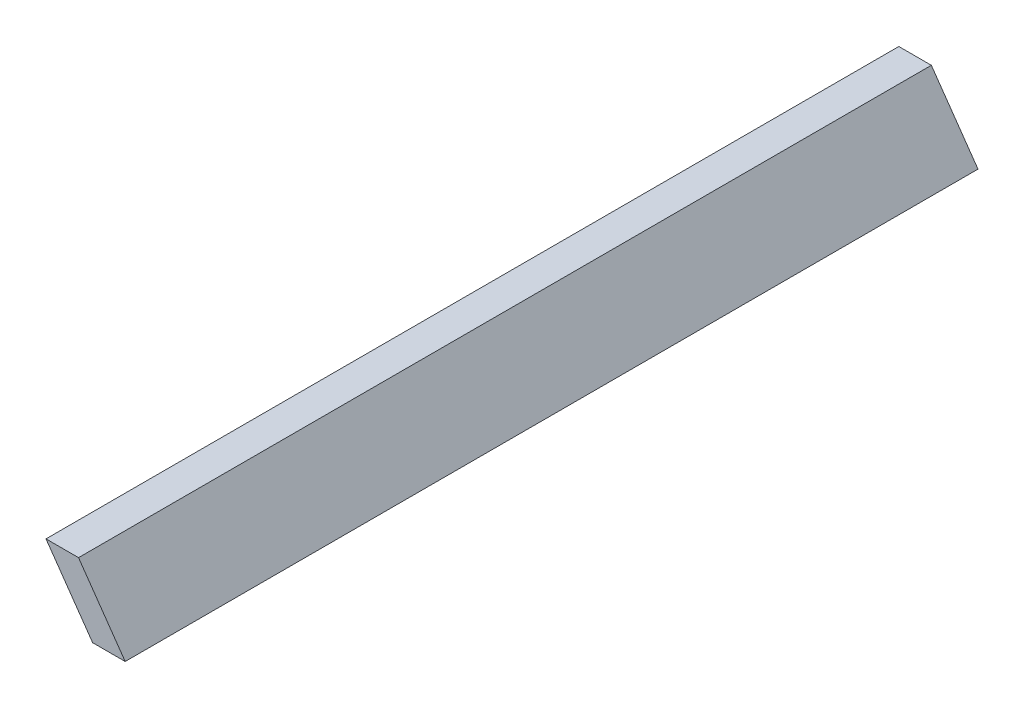
from build123d import *

# Parameters (mm, degrees)
BOSS_EXTRUDE1_DEPTH = 203.2
CUT_EXTRUDE1_DEPTH  = 7.112


with BuildPart() as part:
    # end-profile → Boss-Extrude1 (new body)
    with BuildSketch(Plane.XY):
        Polygon((0, 0), (-7.751918639, 0), (-18.867713308, 15.875), (-11.115794669, 15.875), align=None)
    extrude(amount=BOSS_EXTRUDE1_DEPTH)

    # Sketch4 → Cut-Extrude1 (cut)
    with BuildSketch(Plane(origin=(-18.867713308, 0, 0), x_dir=(0, 0, -1), z_dir=(1, 0, 0))):
        with BuildLine():
            Line((-181.18709, 7.9375), (-181.18709, 0))
            Line((-181.18709, 0), (-174.41291, 0))
            Line((-174.41291, 0), (-174.41291, 7.9375))
            ThreePointArc((-174.41291, 7.9375), (-177.8, 11.32459), (-181.18709, 7.9375))
        make_face()
        with BuildLine():
            Line((-143.08709, 7.9375), (-143.08709, 0))
            Line((-143.08709, 0), (-136.31291, 0))
            Line((-136.31291, 0), (-136.31291, 7.9375))
            ThreePointArc((-136.31291, 7.9375), (-139.7, 11.32459), (-143.08709, 7.9375))
        make_face()
        with BuildLine():
            Line((-104.98709, 7.9375), (-104.98709, 0))
            Line((-104.98709, 0), (-98.21291, 0))
            Line((-98.21291, 0), (-98.21291, 7.9375))
            ThreePointArc((-98.21291, 7.9375), (-101.6, 11.32459), (-104.98709, 7.9375))
        make_face()
        with BuildLine():
            Line((-66.88709, 7.9375), (-66.88709, 0))
            Line((-66.88709, 0), (-60.11291, 0))
            Line((-60.11291, 0), (-60.11291, 7.9375))
            ThreePointArc((-60.11291, 7.9375), (-63.5, 11.32459), (-66.88709, 7.9375))
        make_face()
        with BuildLine():
            Line((-28.78709, 7.9375), (-28.78709, 0))
            Line((-28.78709, 0), (-22.01291, 0))
            Line((-22.01291, 0), (-22.01291, 7.9375))
            ThreePointArc((-22.01291, 7.9375), (-25.4, 11.32459), (-28.78709, 7.9375))
        make_face()
    extrude(amount=CUT_EXTRUDE1_DEPTH, mode=Mode.SUBTRACT)


solid = part.part
